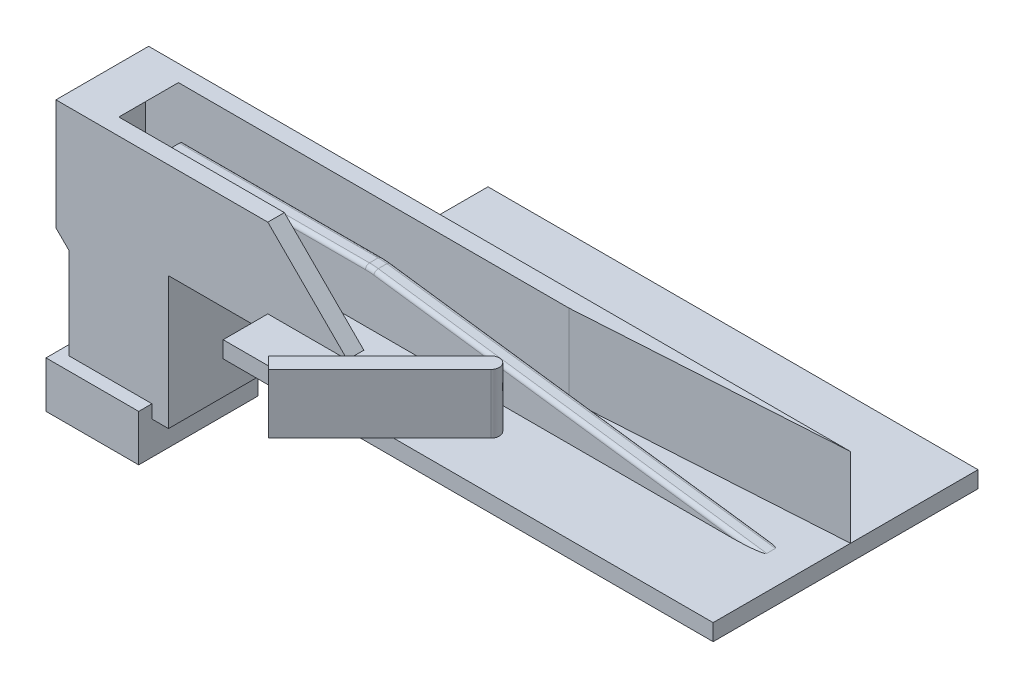
from build123d import *
from OCP.BRepFilletAPI import BRepFilletAPI_MakeChamfer

# Parameters (mm, degrees)
SKETCH1_W            = 93.98
SKETCH1_H            = 50.8
BOSS_EXTRUDE1_DEPTH  = 3.175
BOSS_EXTRUDE2_DEPTH  = 3.175
FILLET1_R            = 0.762
BOSS_EXTRUDE3_DEPTH  = 11.43
FILLET2_R            = 1.6002
SKETCH4_W            = 3.175
SKETCH4_H            = 15.24
SKETCH4_H_2          = 3.175
BOSS_EXTRUDE4_DEPTH  = 38.1
CHAMFER1_SIZE        = 15.24
SKETCH8_W            = 19.05
SKETCH8_H            = 17.78
BOSS_EXTRUDE5_DEPTH  = 25.4
SKETCH9_W            = 7.62
SKETCH9_H            = 11.43
CUT_EXTRUDE3_DEPTH   = 110.809108912
CHAMFER2_SIZE        = 3.175
CHAMFER2_SIZE_2      = 25.4
SKETCH14_W           = 17.78
SKETCH14_H           = 22.86
SKETCH14_W_2         = 7.62
SKETCH14_H_2         = 11.43
BOSS_EXTRUDE11_DEPTH = 2.54
SKETCH10_W           = 17.78
SKETCH10_H           = 22.86
SKETCH10_W_2         = 12.7
SKETCH10_H_2         = 17.78
BOSS_EXTRUDE12_DEPTH = 6.35
SKETCH11_W           = 6.35
SKETCH11_H           = 3.175
BOSS_EXTRUDE7_DEPTH  = 14.605
CHAMFER3_SIZE        = 3.175
SKETCH13_W           = 17.78
SKETCH13_H           = 20.6375
BOSS_EXTRUDE8_DEPTH  = 2.54
CHAMFER4_SIZE        = 3.175
SKETCH15_W           = 93.98
SKETCH15_H           = 15.24
BOSS_EXTRUDE13_DEPTH = 3.175
CHAMFER5_SIZE        = 3.175
CHAMFER5_SIZE_2      = 50.8
SKETCH17_W           = 26.67
SKETCH17_H           = 14.605
BOSS_EXTRUDE14_DEPTH = 3.175


# Some blends are built 0.0001 mm under size
with BuildPart() as part:
    # Sketch1 → Boss-Extrude1 (new body)
    with BuildSketch(Plane(origin=(0, 0, 0), x_dir=(1, 0, 0), z_dir=(0, 1, 0))):
        with Locations((46.99, 25.4)):
            Rectangle(SKETCH1_W, SKETCH1_H)
    extrude(amount=BOSS_EXTRUDE1_DEPTH)

    # Sketch2 → Boss-Extrude2 (add)
    with BuildSketch(Plane.XY.offset(-19.05)):
        with BuildLine():
            Line((87.63, 3.175), (13.127130217, 13.221093478))
            ThreePointArc((13.127130217, 13.221093478), (12.280474231, 13.306491372), (11.43, 13.335))
            Line((11.43, 13.335), (-26.67, 13.335))
            Line((-26.67, 13.335), (-26.67, 3.175))
            Line((-26.67, 3.175), (87.63, 3.175))
        make_face()
    extrude(amount=BOSS_EXTRUDE2_DEPTH)

    # Fillet1
    fillet1_edges = [part.edges().sort_by_distance(p)[0] for p in [
        (50.378565109, 8.198046739, -19.05),
        (12.280474231, 13.306491372, -19.05),
        (-7.62, 13.335, -19.05),
        (50.378565109, 8.198046739, -15.875),
        (12.280474231, 13.306491372, -15.875),
        (-7.62, 13.335, -15.875),
    ]]
    fillet(fillet1_edges, radius=FILLET1_R)

    # Sketch3 → Boss-Extrude3 (add)
    with BuildSketch(Plane(origin=(0, 3.175, 0), x_dir=(1, 0, 0), z_dir=(0, 1, 0))):
        Polygon((43.18, 10.45493597), (40.93493597, 12.7), (18.484295667, -9.750640303), (20.729359697, -11.995704333), align=None)
    extrude(amount=BOSS_EXTRUDE3_DEPTH)

    # Fillet2
    # the kernel refuses this fillet: 1.6002 mm, written as the material it takes off along each edge
    with BuildSketch(Plane(origin=(40.93493597, 3.175, -12.7), x_dir=(0.7071067811865515, 0, 0.7071067811865437), z_dir=(0, 1, 0)), Plane(origin=(43.18, 3.175, -10.45493597), x_dir=(-0.7071067811865437, 0, 0.7071067811865515), z_dir=(0, 1, 0))) as fillet2_piece_1:
        with BuildLine():
            CenterArc((FILLET2_R, -FILLET2_R), FILLET2_R, 90, 90)
            Line((0, -FILLET2_R), (0, 0))
            Line((0, 0), (FILLET2_R, 0))
        make_face()
    extrude(amount=15.4305, mode=Mode.SUBTRACT)

    # Sketch4 → Boss-Extrude4 (add)
    with BuildSketch(Plane.ZY):
        with Locations((-24.765, 10.795)):
            Rectangle(SKETCH4_W, SKETCH4_H)
        with Locations((-10.16, 10.795)):
            Rectangle(SKETCH4_W, SKETCH4_H)
        with Locations((-10.16, 1.5875)):
            Rectangle(SKETCH4_W, SKETCH4_H_2)
        with Locations((-24.765, 1.5875)):
            Rectangle(SKETCH4_W, SKETCH4_H_2)
    extrude(amount=BOSS_EXTRUDE4_DEPTH)

    # Chamfer1
    chamfer1_edges = [part.edges().sort_by_distance(p)[0] for p in [
        (0, 3.175, -10.16),
        (0, 3.175, -24.765),
    ]]
    chamfer(chamfer1_edges, length=CHAMFER1_SIZE - 0.0001)  # a hair under: the kernel refuses the full size

    # Sketch8 → Boss-Extrude5 (add)
    with BuildSketch(Plane.XZ):
        with Locations((-28.575, -17.4625)):
            Rectangle(SKETCH8_W, SKETCH8_H)
    extrude(amount=BOSS_EXTRUDE5_DEPTH)

    # Sketch9 → Cut-Extrude3 (cut, through all)
    with BuildSketch(Plane(origin=(0, 0, 0), x_dir=(1, 0, 0), z_dir=(0, 1, 0))):
        with Locations((-31.115, 17.4625)):
            Rectangle(SKETCH9_W, SKETCH9_H)
    extrude(amount=-CUT_EXTRUDE3_DEPTH, mode=Mode.SUBTRACT)

    # Chamfer2
    chamfer2_edges_1 = [part.edges().sort_by_distance(p)[0] for p in [
        (-27.305, 0, -17.4625),
    ]]
    chamfer2_side_1 = [part.faces().sort_by_distance(p)[0] for p in [
        (-27.2415, 0, -17.4625),
    ]]
    chamfer2_edges_2 = [part.edges().sort_by_distance(p)[0] for p in [
        (-34.925, 0, -17.4625),
    ]]
    chamfer2_side_2 = [part.faces().sort_by_distance(p)[0] for p in [
        (-34.9885, 0, -17.4625),
    ]]
    chamfer2 = BRepFilletAPI_MakeChamfer(part.part.solid().wrapped)
    for e in chamfer2_edges_1:
        chamfer2.Add(CHAMFER2_SIZE - 0.0001, CHAMFER2_SIZE_2 - 0.0001, e.wrapped, chamfer2_side_1[0].wrapped)
    for e in chamfer2_edges_2:
        chamfer2.Add(CHAMFER2_SIZE - 0.0001, CHAMFER2_SIZE_2 - 0.0001, e.wrapped, chamfer2_side_2[0].wrapped)
    add(Compound.cast(chamfer2.Shape()), mode=Mode.REPLACE)  # a hair under: the kernel refuses the full size

    # Sketch14 → Boss-Extrude11 (add)
    with BuildSketch(Plane.XZ.offset(25.4)):
        with Locations((-31.115, -17.4625)):
            Rectangle(SKETCH14_W, SKETCH14_H)
        with Locations((-31.115, -17.4625)):
            Rectangle(SKETCH14_W_2, SKETCH14_H_2, mode=Mode.SUBTRACT)
    extrude(amount=-BOSS_EXTRUDE11_DEPTH)

    # Sketch10 → Boss-Extrude12 (add)
    with BuildSketch(Plane.XZ.offset(25.4)):
        with Locations((-31.115, -17.4625)):
            Rectangle(SKETCH10_W, SKETCH10_H)
        with Locations((-31.115, -17.4625)):
            Rectangle(SKETCH10_W_2, SKETCH10_H_2, mode=Mode.SUBTRACT)
    extrude(amount=BOSS_EXTRUDE12_DEPTH)

    # Sketch11 → Boss-Extrude7 (add)
    with BuildSketch(Plane(origin=(0, 0, -11.7475), x_dir=(-1, 0, 0), z_dir=(0, 0, -1))):
        with Locations((34.925, 16.8275)):
            Rectangle(SKETCH11_W, SKETCH11_H)
    extrude(amount=BOSS_EXTRUDE7_DEPTH)

    # Chamfer3
    chamfer3_edges = [part.edges().sort_by_distance(p)[0] for p in [
        (-31.75, 15.24, -17.4625),
    ]]
    chamfer(chamfer3_edges, length=CHAMFER3_SIZE - 0.0001)  # a hair under: the kernel refuses the full size

    # Sketch13 → Boss-Extrude8 (add)
    with BuildSketch(Plane.ZY.offset(38.1)):
        with Locations((-17.4625, 8.09625)):
            Rectangle(SKETCH13_W, SKETCH13_H)
    extrude(amount=BOSS_EXTRUDE8_DEPTH)

    # Chamfer4
    # the kernel refuses this chamfer: 3.175 mm, written as the material it adds along each edge
    with BuildSketch(Plane(origin=(-38.1, -2.2225, -8.5725), x_dir=(0.02749587661058565, -0.9996219169112968, 0), z_dir=(0, 0, -1))) as chamfer4_piece_1_section:
        Polygon((CHAMFER4_SIZE * 0.999621916911, CHAMFER4_SIZE * 0.0274958766106), (-CHAMFER4_SIZE * 0.0274958766106, CHAMFER4_SIZE * 0.999621916911), (0, 0), align=None)
    chamfer4_piece_1 = extrude(amount=17.78, mode=Mode.PRIVATE)
    chamfer4_piece_1 = split(chamfer4_piece_1, bisect_by=Plane(origin=(-40.64, -3.320155959, -17.4625), z_dir=(1, 0, 0)), keep=Keep.TOP, mode=Mode.PRIVATE)
    add(chamfer4_piece_1)

    # Sketch15 → Boss-Extrude13 (add)
    with BuildSketch(Plane(origin=(0, 0, -26.3525), x_dir=(-1, 0, 0), z_dir=(0, 0, -1))):
        with Locations((-46.99, 10.795)):
            Rectangle(SKETCH15_W, SKETCH15_H)
    extrude(amount=-BOSS_EXTRUDE13_DEPTH)

    # Chamfer5
    # the kernel refuses this chamfer: 50.8, 3.175 mm, written as the material it takes off along each edge
    with BuildSketch(Plane(origin=(93.98, 150.485487252, -23.1775), x_dir=(0.5233850041899423, 0, -0.8520963193143684), z_dir=(0, -1, 0))) as chamfer5_piece_1:
        Polygon((CHAMFER5_SIZE * 0.852096319314, -CHAMFER5_SIZE * 0.52338500419), (-CHAMFER5_SIZE_2 * 0.52338500419, -CHAMFER5_SIZE_2 * 0.852096319314), (0, 0), align=None)
    extrude(amount=147.310487252, mode=Mode.SUBTRACT)

    # Sketch17 → Boss-Extrude14 (add)
    with BuildSketch(Plane.XZ.offset(-3.175)):
        with Locations((-13.335, -19.05)):
            Rectangle(SKETCH17_W, SKETCH17_H)
    extrude(amount=BOSS_EXTRUDE14_DEPTH)


solid = part.part
